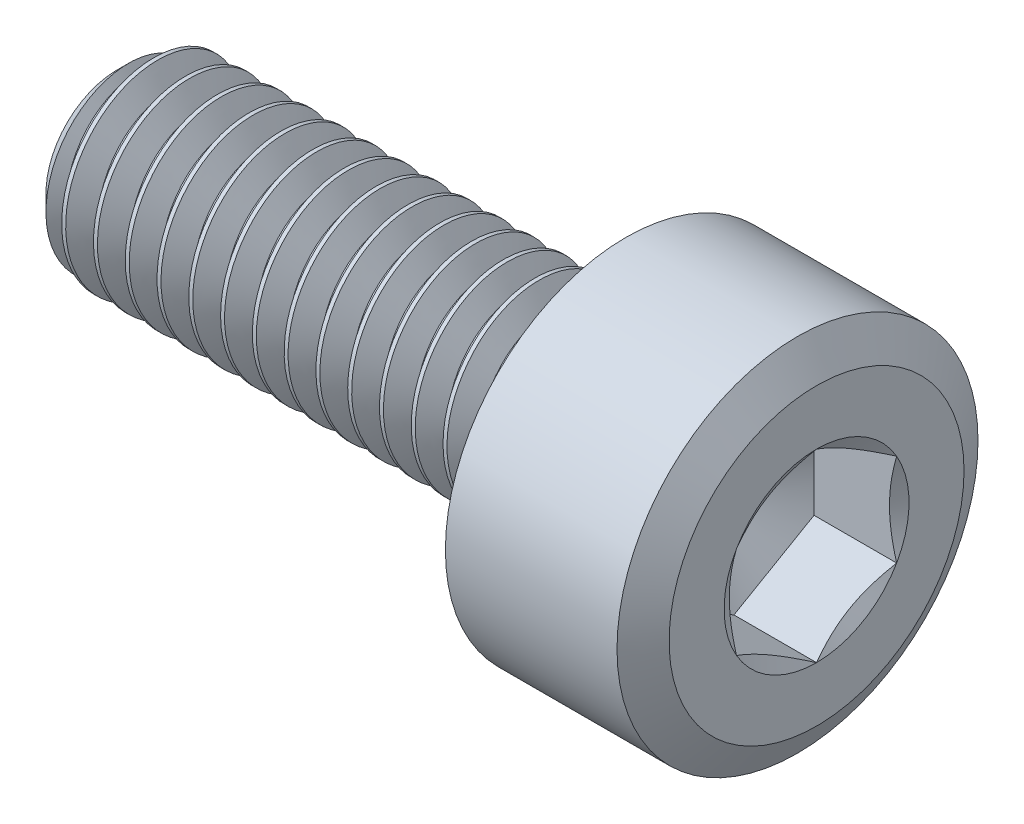
from build123d import *

# Parameters (mm, degrees)
CUT_EXTRUDE1_DEPTH = 1.3
SKETCH7_R          = 1.454922678
CUT_EXTRUDE3_DEPTH = 0.55
CUT_EXTRUDE3_DRAFT = -60
CUT_SWEEP1_PITCH   = 0.5


with BuildPart() as part:
    # Sketch2 → Revolve1 (revolve)
    with BuildSketch(Plane.XY, mode=Mode.PRIVATE) as revolve1_sk:
        with BuildLine():
            Line((-5.5, 1.125), (-5.5, 0))
            Line((-5.5, 0), (4.2, 0))
            Line((4.2, 0), (4.2, 1.26))
            Line((4.2, 1.26), (5.5, 1.26))
            Line((5.5, 1.26), (5.5, 2.320384758))
            Line((5.5, 2.320384758), (5.2, 2.84))
            Line((5.2, 2.84), (2.5, 2.84))
            Line((2.5, 2.84), (2.5, 1.8))
            ThreePointArc((2.5, 1.8), (2.412132034, 1.587867966), (2.2, 1.5))
            Line((2.2, 1.5), (-5.125, 1.5))
            Line((-5.125, 1.5), (-5.5, 1.125))
        make_face()
    revolve(revolve1_sk.sketch.rotate(Axis((5.5, 0, 0), (-1, 0, 0)), 90), axis=Axis((5.5, 0, 0), (-1, 0, 0)))

    # Sketch3 → Cut-Extrude1 (cut)
    with BuildSketch(Plane(origin=(5.5, 0, 0), x_dir=(0, 0, -1), z_dir=(1, 0, 0))):
        Polygon((0, 1.454922678), (-1.26, 0.727461339), (-1.26, -0.727461339), (0, -1.454922678), (1.26, -0.727461339), (1.26, 0.727461339), align=None)
    extrude(amount=-CUT_EXTRUDE1_DEPTH, mode=Mode.SUBTRACT)

    # Cut-Extrude2 cone 1 section (through the dimple's axis) → Cut-Extrude2 (revolve, cut)
    with BuildSketch(Plane(origin=(5.5, 0, 0), x_dir=(0, 0, -1), z_dir=(0, 1, 0))):
        Polygon((0, 0), (1.454922678, 0), (0, 0.84), align=None)
    revolve(axis=Axis((5.5, 0, 0), (-1, 0, 0)), mode=Mode.SUBTRACT)


with BuildPart() as cut_extrude3_tool:
    # Sketch7 → Cut-Extrude3 (with draft: the straight prism first)
    with BuildSketch(Plane(origin=(4.2, 0, 0), x_dir=(0, 0, -1), z_dir=(1, 0, 0))):
        Circle(SKETCH7_R)
    extrude(amount=-CUT_EXTRUDE3_DEPTH)
    # Cut-Extrude3: the draft: its side faces are tilted about the plane it starts from
    cut_extrude3_sides = [cut_extrude3_tool.faces().sort_by_distance(p)[0] for p in [
        (3.925, 0, 1.454922678),
    ]]
    draft(cut_extrude3_sides, Plane(origin=(4.2, 0, 0), x_dir=(0, 0, -1), z_dir=(1, 0, 0)), CUT_EXTRUDE3_DRAFT)


with BuildPart() as part_1:
    add(part.part)

    # Cut-Extrude3: cut by cut_extrude3_tool
    add(cut_extrude3_tool.part, mode=Mode.SUBTRACT)


with BuildPart() as body_2:
    # Split1: the piece on the far side of the plane
    add(part_1.part)
    split(bisect_by=Plane(origin=(2.2, 0, 0), x_dir=(0, 0, 1), z_dir=(1, 0, 0)), keep=Keep.BOTTOM)

    # Cut-Sweep1: the profile of Sketch5 screwed along a right-hand helix of 17 turns, 6 arcs to a turn; built about Z, then put on its axis
    cut_sweep1_z = Axis((0, 0, 0), (0, 0, 1))
    cut_sweep1_corners = [(1.527063294, 0, -0.453125), (1.527063294, 0, 0.015625), (1.175240474, 0, -0.1875), (1.175240474, 0, -0.25)]
    with BuildLine(mode=Mode.PRIVATE) as cut_sweep1_profile:
        Line(cut_sweep1_corners[0], cut_sweep1_corners[1])
        Line(cut_sweep1_corners[1], cut_sweep1_corners[2])
        Line(cut_sweep1_corners[2], cut_sweep1_corners[3])
        Line(cut_sweep1_corners[3], cut_sweep1_corners[0])
    cut_sweep1_cap = Face(cut_sweep1_profile.wire())
    cut_sweep1_turn_angles = [0, 30, 60, 90, 120, 150, 180, 210, 240, 270, 300, 330, 360]
    cut_sweep1_turn_weights = [1, 0.8660254037844387, 1, 0.8660254037844387, 1, 0.8660254037844387, 1, 0.8660254037844387, 1, 0.8660254037844387, 1, 0.8660254037844387, 1]
    cut_sweep1_turn_rails = [Edge.make_bspline([Vector(p[0], p[1], 0).rotate(cut_sweep1_z, cut_sweep1_turn_angles[k]) / cut_sweep1_turn_weights[k] + Vector(0, 0, p[2] + CUT_SWEEP1_PITCH * cut_sweep1_turn_angles[k] / 360) for k in range(13)], [0, 0, 0, 1, 1, 2, 2, 3, 3, 4, 4, 5, 5, 6, 6, 6], 2, cut_sweep1_turn_weights) for p in cut_sweep1_corners]
    cut_sweep1_turn_sides = [Face.make_surface_from_curves(cut_sweep1_turn_rails[p[0]], cut_sweep1_turn_rails[p[1]]) for p in [(0, 1), (1, 2), (2, 3), (3, 0)]]
    cut_sweep1 = Plane(origin=(-5.5, 0, 0), x_dir=(0, 1, 0), z_dir=(1, 0, 0)) * Solid(Shell([*[p.moved(Location((0, 0, CUT_SWEEP1_PITCH * i))) for i in range(17) for p in cut_sweep1_turn_sides], cut_sweep1_cap, cut_sweep1_cap.rotate(cut_sweep1_z, 6120).moved(Location((0, 0, CUT_SWEEP1_PITCH * 6120 / 360)))]))
    add(cut_sweep1, mode=Mode.SUBTRACT)


with BuildPart() as part_2:
    add(part_1.part)

    # Split1
    split(bisect_by=Plane(origin=(2.2, 0, 0), x_dir=(0, 0, 1), z_dir=(1, 0, 0)), keep=Keep.TOP)


with BuildPart() as body_2_1:
    add(body_2.part)

    # Combine1: union part
    add(part_2.part)


solid = body_2_1.part
